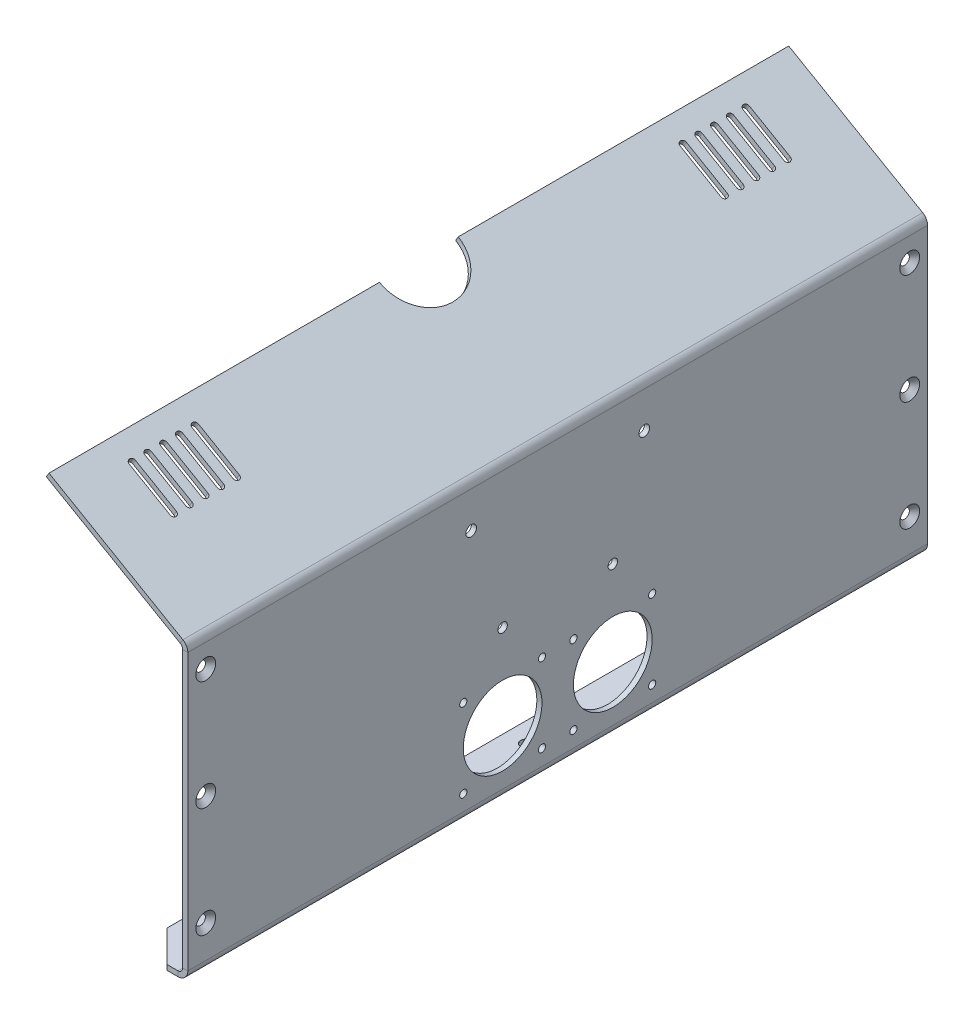
from build123d import *

# Parameters (mm, degrees)
BASE_FLANGE1_DEPTH = 235
SKETCH6_R          = 3.5
CUT_EXTRUDE1_DEPTH = 10
CHAMFER1_SIZE      = 20
SKETCH8_R          = 3
CUT_EXTRUDE3_DEPTH = 3.26
SKETCH11_R         = 2.286
SKETCH11_R_2       = 25
CUT_EXTRUDE5_DEPTH = 3.26
SKETCH12_R         = 3
CUT_EXTRUDE6_DEPTH = 10
CUT_EXTRUDE7_DEPTH = 10
CUT_EXTRUDE8_DEPTH = 10
CHAMFER2_SIZE      = 3.3
SKETCH15_R         = 3.375
CUT_EXTRUDE9_DEPTH = 10


# Sheet-metal steps are written as plain solids
with BuildPart() as part:
    # Sketch1 → Base-Flange1 (new, symmetric)
    with BuildSketch(Plane.XY):
        with BuildLine():
            Line((-30, 0), (-3.048, 0))
            ThreePointArc((-3.048, 0), (-0.892738531, 0.892738531), (0, 3.048))
            Line((0, 3.048), (0, 178.24023638))
            ThreePointArc((0, 178.24023638), (-0.408354569, 179.76423638), (-1.524, 180.87988181))
            Line((-1.524, 180.87988181), (-86.602540378, 230))
            Line((-86.602540378, 230), (-84.972540378, 232.823242816))
            Line((-84.972540378, 232.823242816), (0.106, 183.703124627))
            ThreePointArc((0.106, 183.703124627), (2.414888247, 181.39423638), (3.26, 178.24023638))
            Line((3.26, 178.24023638), (3.26, 3.048))
            ThreePointArc((3.26, 3.048), (1.412429576, -1.412429576), (-3.048, -3.26))
            Line((-3.048, -3.26), (-30, -3.26))
            Line((-30, -3.26), (-30, 0))
        make_face()
    extrude(amount=BASE_FLANGE1_DEPTH, both=True)

    # Sketch6 → Cut-Extrude1 (cut)
    with BuildSketch(Plane(origin=(0, 0, 0), x_dir=(1, 0, 0), z_dir=(0, 1, 0))):
        with Locations(Location((-17.387, 0.59516, 0), (0, 0, 270))):
            Circle(SKETCH6_R)
        with Locations(Location((-17.387, -199.40484, 0), (0, 0, 270))):
            Circle(SKETCH6_R)
        with Locations(Location((-17.387, -99.40484, 0), (0, 0, 270))):
            Circle(SKETCH6_R)
        with Locations(Location((-17.387, 200.59516, 0), (0, 0, 270))):
            Circle(SKETCH6_R)
        with Locations(Location((-17.387, 100.59516, 0), (0, 0, 270))):
            Circle(SKETCH6_R)
    extrude(amount=-CUT_EXTRUDE1_DEPTH, mode=Mode.SUBTRACT)

    # Chamfer1
    chamfer1_edges = [part.edges().sort_by_distance(p)[0] for p in [
        (-30, -1.63, -235),
        (-30, -1.63, 235),
    ]]
    chamfer(chamfer1_edges, length=CHAMFER1_SIZE)

    # Sketch8 → Cut-Extrude3 (cut)
    with BuildSketch(Plane(origin=(3.26, 0, 0), x_dir=(0, 0, -1), z_dir=(1, 0, 0))):
        with Locations((-223.61916, 163.426)):
            Circle(SKETCH8_R)
        with Locations((-223.61916, 93.576)):
            Circle(SKETCH8_R)
        with Locations((-223.61916, 23.726)):
            Circle(SKETCH8_R)
        with Locations(Location((223.61916, 23.726, 0), (0, 0, 180))):
            Circle(SKETCH8_R)
        with Locations(Location((223.61916, 93.576, 0), (0, 0, 180))):
            Circle(SKETCH8_R)
        with Locations(Location((223.61916, 163.426, 0), (0, 0, 180))):
            Circle(SKETCH8_R)
    extrude(amount=-CUT_EXTRUDE3_DEPTH, mode=Mode.SUBTRACT)

    # Sketch11 → Cut-Extrude5 (cut)
    with BuildSketch(Plane(origin=(3.26, 0, 0), x_dir=(0, 0, -1), z_dir=(1, 0, 0))):
        with Locations(Location((-60, 63.048, 0), (0, 0, 90))):
            Circle(SKETCH11_R)
        with Locations(Location((-10, 63.048, 0), (0, 0, 90))):
            Circle(SKETCH11_R)
        with Locations(Location((-10, 13.048, 0), (0, 0, 90))):
            Circle(SKETCH11_R)
        with Locations(Location((-60, 13.048, 0), (0, 0, 90))):
            Circle(SKETCH11_R)
        with Locations(Location((-35, 38.048, 0), (0, 0, 90))):
            Circle(SKETCH11_R_2)
        with Locations(Location((35, 38.048, 0), (0, 0, 180))):
            Circle(SKETCH11_R_2)
        with Locations(Location((60, 13.048, 0), (0, 0, 180))):
            Circle(SKETCH11_R)
        with Locations(Location((10, 13.048, 0), (0, 0, 180))):
            Circle(SKETCH11_R)
        with Locations(Location((10, 63.048, 0), (0, 0, 180))):
            Circle(SKETCH11_R)
        with Locations(Location((60, 63.048, 0), (0, 0, 180))):
            Circle(SKETCH11_R)
    extrude(amount=-CUT_EXTRUDE5_DEPTH, mode=Mode.SUBTRACT)

    # Sketch12 → Cut-Extrude6 (cut)
    with BuildSketch(Plane.ZY):
        with Locations((35, 91.949)):
            Circle(SKETCH12_R)
        with Locations((-35, 91.949)):
            Circle(SKETCH12_R)
    extrude(amount=-CUT_EXTRUDE6_DEPTH, mode=Mode.SUBTRACT)

    # Sketch13 → Cut-Extrude7 (cut)
    with BuildSketch(Plane(origin=(79.572286341, 137.823242816, 0), x_dir=(0.8660254037844399, -0.4999999999999977, 0), z_dir=(0.4999999999999977, 0.8660254037844399, 0))):
        with BuildLine():
            Line((-175, 197), (-145, 197))
            ThreePointArc((-145, 197), (-143, 195), (-145, 193))
            Line((-145, 193), (-175, 193))
            ThreePointArc((-175, 193), (-177, 195), (-175, 197))
        make_face()
        with BuildLine():
            Line((-175, 187), (-145, 187))
            ThreePointArc((-145, 187), (-143, 185), (-145, 183))
            Line((-145, 183), (-175, 183))
            ThreePointArc((-175, 183), (-177, 185), (-175, 187))
        make_face()
        with BuildLine():
            Line((-175, 177), (-145, 177))
            ThreePointArc((-145, 177), (-143, 175), (-145, 173))
            Line((-145, 173), (-175, 173))
            ThreePointArc((-175, 173), (-177, 175), (-175, 177))
        make_face()
        with BuildLine():
            Line((-175, 167), (-145, 167))
            ThreePointArc((-145, 167), (-143, 165), (-145, 163))
            Line((-145, 163), (-175, 163))
            ThreePointArc((-175, 163), (-177, 165), (-175, 167))
        make_face()
        with BuildLine():
            Line((-175, 157), (-145, 157))
            ThreePointArc((-145, 157), (-143, 155), (-145, 153))
            Line((-145, 153), (-175, 153))
            ThreePointArc((-175, 153), (-177, 155), (-175, 157))
        make_face()
        with BuildLine():
            Line((-175, -197), (-145, -197))
            ThreePointArc((-145, -197), (-143, -195), (-145, -193))
            Line((-145, -193), (-175, -193))
            ThreePointArc((-175, -193), (-177, -195), (-175, -197))
        make_face()
        with BuildLine():
            Line((-175, -187), (-145, -187))
            ThreePointArc((-145, -187), (-143, -185), (-145, -183))
            Line((-145, -183), (-175, -183))
            ThreePointArc((-175, -183), (-177, -185), (-175, -187))
        make_face()
        with BuildLine():
            Line((-175, -177), (-145, -177))
            ThreePointArc((-145, -177), (-143, -175), (-145, -173))
            Line((-145, -173), (-175, -173))
            ThreePointArc((-175, -173), (-177, -175), (-175, -177))
        make_face()
        with BuildLine():
            Line((-175, -167), (-145, -167))
            ThreePointArc((-145, -167), (-143, -165), (-145, -163))
            Line((-145, -163), (-175, -163))
            ThreePointArc((-175, -163), (-177, -165), (-175, -167))
        make_face()
        with BuildLine():
            Line((-175, -157), (-145, -157))
            ThreePointArc((-145, -157), (-143, -155), (-145, -153))
            Line((-145, -153), (-175, -153))
            ThreePointArc((-175, -153), (-177, -155), (-175, -157))
        make_face()
    extrude(amount=-CUT_EXTRUDE7_DEPTH, mode=Mode.SUBTRACT)

    # Sketch14 → Cut-Extrude8 (cut)
    with BuildSketch(Plane(origin=(79.572286341, 137.823242816, 0), x_dir=(0.8660254037844399, -0.4999999999999977, 0), z_dir=(0.4999999999999977, 0.8660254037844399, 0))):
        with BuildLine():
            Line((-190, 25), (-190, -25))
            ThreePointArc((-190, -25), (-165, 0), (-190, 25))
        make_face()
    extrude(amount=-CUT_EXTRUDE8_DEPTH, mode=Mode.SUBTRACT)

    # Chamfer2
    # the kernel refuses this chamfer: 3.3 mm, written as the material it takes off along each edge
    with BuildSketch(Plane(origin=(3.26, 163.426, -223.61916), x_dir=(0, 0, 1), z_dir=(0, 1, 0))) as chamfer2_piece_1:
        Polygon((3 + CHAMFER2_SIZE, 0), (3, -CHAMFER2_SIZE), (3, 0), align=None)
    revolve(axis=Axis((3.26, 163.426, -223.61916), (1, 0, 0)), mode=Mode.SUBTRACT)
    with BuildSketch(Plane(origin=(3.26, 93.576, -223.61916), x_dir=(0, 0, 1), z_dir=(0, 1, 0))) as chamfer2_piece_2:
        Polygon((3 + CHAMFER2_SIZE, 0), (3, -CHAMFER2_SIZE), (3, 0), align=None)
    revolve(axis=Axis((3.26, 93.576, -223.61916), (1, 0, 0)), mode=Mode.SUBTRACT)
    with BuildSketch(Plane(origin=(3.26, 23.726, -223.61916), x_dir=(0, 0, 1), z_dir=(0, 1, 0))) as chamfer2_piece_3:
        Polygon((3 + CHAMFER2_SIZE, 0), (3, -CHAMFER2_SIZE), (3, 0), align=None)
    revolve(axis=Axis((3.26, 23.726, -223.61916), (1, 0, 0)), mode=Mode.SUBTRACT)
    with BuildSketch(Plane(origin=(3.26, 23.726, 223.61916), x_dir=(0, 0, -1), z_dir=(0, -1, 0))) as chamfer2_piece_4:
        Polygon((3 + CHAMFER2_SIZE, 0), (3, -CHAMFER2_SIZE), (3, 0), align=None)
    revolve(axis=Axis((3.26, 23.726, 223.61916), (1, 0, 0)), mode=Mode.SUBTRACT)
    with BuildSketch(Plane(origin=(3.26, 93.576, 223.61916), x_dir=(0, 0, -1), z_dir=(0, -1, 0))) as chamfer2_piece_5:
        Polygon((3 + CHAMFER2_SIZE, 0), (3, -CHAMFER2_SIZE), (3, 0), align=None)
    revolve(axis=Axis((3.26, 93.576, 223.61916), (1, 0, 0)), mode=Mode.SUBTRACT)
    with BuildSketch(Plane(origin=(3.26, 163.426, 223.61916), x_dir=(0, 0, -1), z_dir=(0, -1, 0))) as chamfer2_piece_6:
        Polygon((3 + CHAMFER2_SIZE, 0), (3, -CHAMFER2_SIZE), (3, 0), align=None)
    revolve(axis=Axis((3.26, 163.426, 223.61916), (1, 0, 0)), mode=Mode.SUBTRACT)

    # Sketch15 → Cut-Extrude9 (cut)
    with BuildSketch(Plane(origin=(3.26, 0, 0), x_dir=(0, 0, -1), z_dir=(1, 0, 0))):
        with Locations((-55, 155.24023638)):
            Circle(SKETCH15_R)
        with Locations((55, 155.24023638)):
            Circle(SKETCH15_R)
    extrude(amount=-CUT_EXTRUDE9_DEPTH, mode=Mode.SUBTRACT)


solid = part.part
